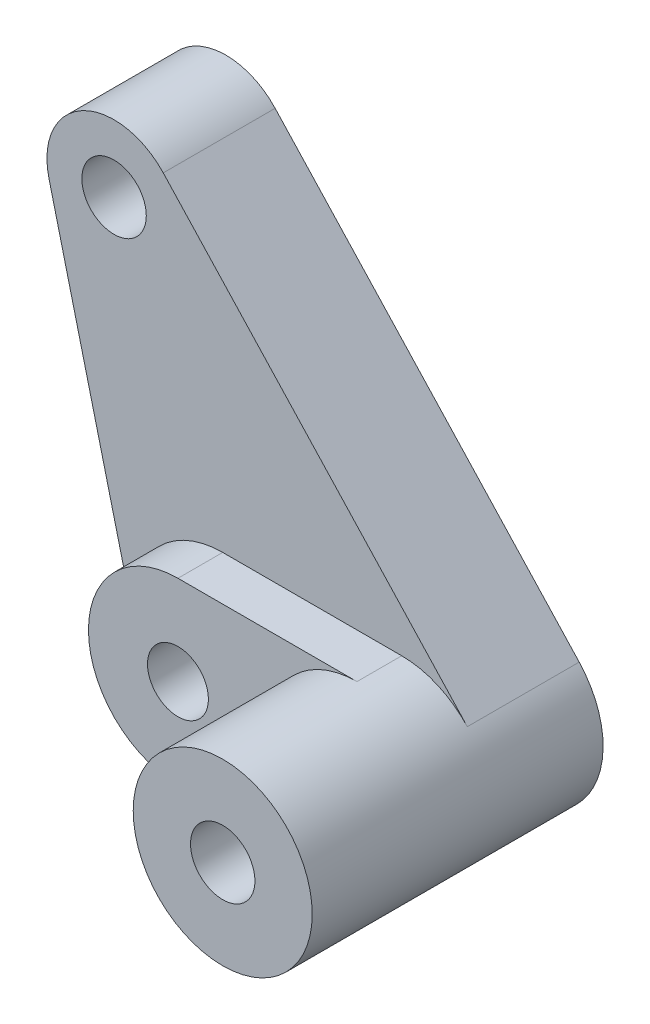
from build123d import *

# Parameters (mm, degrees)
SKETCH1_R           = 2.159
SKETCH1_R_2         = 2.286
BOSS_EXTRUDE1_DEPTH = 3.96875
SKETCH3_R           = 6.35
SKETCH3_R_2         = 2.286
BOSS_EXTRUDE2_DEPTH = 12.7
CUT_EXTRUDE1_DEPTH  = 3.175
BOSS_EXTRUDE3_START = 3.175
SKETCH5_R           = 2.159
BOSS_EXTRUDE3_DEPTH = 3.175


with BuildPart() as part:
    # Sketch1 → Boss-Extrude1 (new, symmetric)
    with BuildSketch(Plane.XY):
        with BuildLine():
            Line((0, -6.35), (-12.7, -6.35))
            ThreePointArc((-12.7, -6.35), (-16.608661537, -5.004484488), (-18.860893238, -1.538146453))
            Line((-18.860893238, -1.538146453), (-25.029176536, 23.16830123))
            ThreePointArc((-25.029176536, 23.16830123), (-22.676738969, 28.509574881), (-16.917846959, 27.561772404))
            Line((-16.917846959, 27.561772404), (4.654212865, 4.319815113))
            ThreePointArc((4.654212865, 4.319815113), (5.820366224, -2.538865301), (0, -6.35))
        make_face()
        with Locations((-12.7, 0)):
            Circle(SKETCH1_R, mode=Mode.SUBTRACT)
        with Locations((-20.408506608, 24.321911069)):
            Circle(SKETCH1_R_2, mode=Mode.SUBTRACT)
        Circle(SKETCH1_R_2, mode=Mode.SUBTRACT)
    extrude(amount=BOSS_EXTRUDE1_DEPTH, both=True)

    # Sketch3 → Boss-Extrude2 (add)
    with BuildSketch(Plane.XY.offset(3.96875)):
        Circle(SKETCH3_R)
        Circle(SKETCH3_R_2, mode=Mode.SUBTRACT)
    extrude(amount=BOSS_EXTRUDE2_DEPTH)

    # Sketch4 → Cut-Extrude1 (cut)
    with BuildSketch(Plane(origin=(0, 0, -3.96875), x_dir=(-1, 0, 0), z_dir=(0, 0, -1))):
        Polygon((12.7, 5.132643893), (8.255, 2.566321947), (8.255, -2.566321947), (12.7, -5.132643893), (17.145, -2.566321947), (17.145, 2.566321947), align=None)
    extrude(amount=-CUT_EXTRUDE1_DEPTH, mode=Mode.SUBTRACT)

    # Sketch5 → Boss-Extrude3 (add)
    with BuildSketch(Plane.XY.offset(3.96875).offset(BOSS_EXTRUDE3_START)):
        with BuildLine():
            Line((-12.7, 6.35), (0, 6.35))
            ThreePointArc((0, 6.35), (-6.35, 0), (0, -6.35))
            Line((0, -6.35), (-12.7, -6.35))
            ThreePointArc((-12.7, -6.35), (-19.05, 0), (-12.7, 6.35))
        make_face()
        with Locations((-12.7, 0)):
            Circle(SKETCH5_R, mode=Mode.SUBTRACT)
    extrude(amount=-BOSS_EXTRUDE3_DEPTH)


solid = part.part
